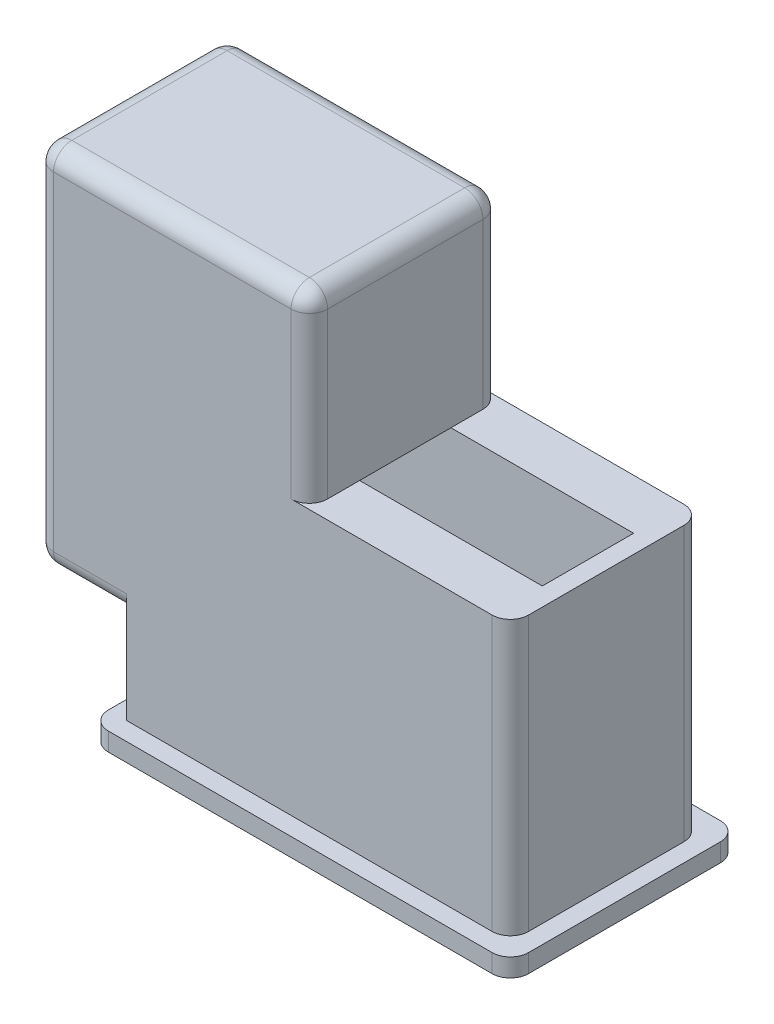
from build123d import *

# Parameters (mm, degrees)
SKETCH2_W               = 210
SKETCH2_H               = 105
SKETCH2_W_2             = 190
SKETCH2_H_2             = 50
BOSS_EXTRUDE2_DEPTH     = 150
FILLET3_R               = 10
FILLET4_R               = 10
SKETCH4_W               = 230
SKETCH4_H               = 125
BOSS_EXTRUDE3_DEPTH     = 10
FILLET5_R               = 10
FILLET6_R               = 10
FILLET7_R               = 10
FILLET8_R               = 10
SKETCH7_W               = 10
SKETCH7_H               = 50
BOSS_EXTRUDE4_DEPTH     = 93.9
SKETCH8_R               = 16.1
CUT_EXTRUDE2_DEPTH      = 10
SKETCH10_R              = 16.1
CUT_EXTRUDE3_DEPTH      = 10
SKETCH14_W              = 150
SKETCH14_H              = 105
BOSS_EXTRUDE6_DEPTH     = 100
CUT_EXTRUDE4_DEPTH      = 1
CUT_EXTRUDE4_DEPTH_BACK = 145
SKETCH19_W              = 95
SKETCH19_H              = 90
SKETCH22_W              = 50
SKETCH22_H              = 105
SKETCH22_W_2            = 35
SKETCH22_H_2            = 95
BOSS_EXTRUDE7_DEPTH     = 100
SKETCH24_W              = 40
SKETCH24_H              = 40
CUT_EXTRUDE5_DEPTH      = 10
SKETCH25_W              = 95.055428317
SKETCH25_H              = 90
BOSS_EXTRUDE9_DEPTH     = 5
FILLET9_R               = 10
FILLET10_R              = 10
FILLET11_R              = 10
FILLET12_R              = 10
FILLET13_R              = 10
FILLET15_R              = 10
SKETCH28_W              = 35
SKETCH28_H              = 95
CUT_EXTRUDE7_DEPTH      = 5


with BuildPart() as part:
    # Sketch2 → Boss-Extrude2 (new body)
    with BuildSketch(Plane(origin=(0, 0, 0), x_dir=(1, 0, 0), z_dir=(0, 1, 0))):
        Rectangle(SKETCH2_W, SKETCH2_H)
        Rectangle(SKETCH2_W_2, SKETCH2_H_2, mode=Mode.SUBTRACT)
    extrude(amount=BOSS_EXTRUDE2_DEPTH)

    # Fillet3
    fillet3_edges = [part.edges().sort_by_distance(p)[0] for p in [
        (105, 75, 52.5),
    ]]
    fillet(fillet3_edges, radius=FILLET3_R)

    # Fillet4
    fillet4_edges = [part.edges().sort_by_distance(p)[0] for p in [
        (105, 75, -52.5),
    ]]
    fillet(fillet4_edges, radius=FILLET4_R)

    # Sketch4 → Boss-Extrude3 (add)
    with BuildSketch(Plane(origin=(0, 0, 0), x_dir=(1, 0, 0), z_dir=(0, 1, 0))):
        Rectangle(SKETCH4_W, SKETCH4_H)
    extrude(amount=-BOSS_EXTRUDE3_DEPTH)

    # Fillet5
    fillet5_edges = [part.edges().sort_by_distance(p)[0] for p in [
        (115, -5, 62.5),
    ]]
    fillet(fillet5_edges, radius=FILLET5_R)

    # Fillet6
    fillet6_edges = [part.edges().sort_by_distance(p)[0] for p in [
        (115, -5, -62.5),
    ]]
    fillet(fillet6_edges, radius=FILLET6_R)

    # Fillet7
    fillet7_edges = [part.edges().sort_by_distance(p)[0] for p in [
        (-115, -5, -62.5),
    ]]
    fillet(fillet7_edges, radius=FILLET7_R)

    # Fillet8
    fillet8_edges = [part.edges().sort_by_distance(p)[0] for p in [
        (-115, -5, 62.5),
    ]]
    fillet(fillet8_edges, radius=FILLET8_R)

    # Sketch7 → Boss-Extrude4 (add)
    with BuildSketch(Plane(origin=(0, 0, 0), x_dir=(1, 0, 0), z_dir=(0, 1, 0))):
        Rectangle(SKETCH7_W, SKETCH7_H)
    extrude(amount=BOSS_EXTRUDE4_DEPTH)

    # Sketch8 → Cut-Extrude2 (cut)
    with BuildSketch(Plane.ZY.offset(5)):
        with Locations((0, 93.9)):
            Circle(SKETCH8_R)
    extrude(amount=-CUT_EXTRUDE2_DEPTH, mode=Mode.SUBTRACT)

    # Sketch10 → Cut-Extrude3 (cut)
    with BuildSketch(Plane.ZY.offset(105)):
        with Locations((0.019819576, 93.900003501)):
            Circle(SKETCH10_R)
    extrude(amount=-CUT_EXTRUDE3_DEPTH, mode=Mode.SUBTRACT)

    # Sketch14 → Boss-Extrude6 (add)
    with BuildSketch(Plane(origin=(0, 150, 0), x_dir=(1, 0, 0), z_dir=(0, 1, 0))):
        with Locations((-80, 0)):
            Rectangle(SKETCH14_W, SKETCH14_H)
    extrude(amount=BOSS_EXTRUDE6_DEPTH)

    # Sketch19 → Cut-Extrude4 (cut, two sides: drawn at the far end of the back side and taken through both)
    with BuildSketch(Plane.ZY.offset(155).offset(-CUT_EXTRUDE4_DEPTH_BACK)):
        with Locations((0, 200)):
            Rectangle(SKETCH19_W, SKETCH19_H)
    extrude(amount=CUT_EXTRUDE4_DEPTH + CUT_EXTRUDE4_DEPTH_BACK, mode=Mode.SUBTRACT)

    # Sketch22 → Boss-Extrude7 (add)
    with BuildSketch(Plane.XZ.offset(-150)):
        with Locations((-130, 0)):
            Rectangle(SKETCH22_W, SKETCH22_H)
        with Locations((-130, 0)):
            Rectangle(SKETCH22_W_2, SKETCH22_H_2, mode=Mode.SUBTRACT)
    extrude(amount=BOSS_EXTRUDE7_DEPTH)

    # Sketch24 → Cut-Extrude5 (cut)
    with BuildSketch(Plane(origin=(-105, 0, 0), x_dir=(0, 0, -1), z_dir=(1, 0, 0))):
        with Locations((-0.019819576, 93.900003501)):
            Rectangle(SKETCH24_W, SKETCH24_H)
    extrude(amount=-CUT_EXTRUDE5_DEPTH, mode=Mode.SUBTRACT)

    # Sketch25 → Boss-Extrude9 (add)
    with BuildSketch(Plane.ZY.offset(155)):
        with Locations((0.027714159, 200)):
            Rectangle(SKETCH25_W, SKETCH25_H)
    extrude(amount=-BOSS_EXTRUDE9_DEPTH)

    # Fillet9
    fillet9_edges = [part.edges().sort_by_distance(p)[0] for p in [
        (-80, 250, -52.5),
        (-155, 250, 0),
        (-80, 250, 52.5),
        (-5, 250, 0),
    ]]
    fillet(fillet9_edges, radius=FILLET9_R)

    # Fillet10
    # the kernel refuses this fillet: 10 mm, written as the material it takes off along each edge
    with BuildSketch(Plane(origin=(-145, 240, 42.5), x_dir=(-1, 0, 0), z_dir=(0, 0, 1))) as fillet10_piece_1_section:
        Polygon((0, 0), (FILLET10_R, 0), (FILLET10_R, -FILLET10_R), (0, -FILLET10_R), align=None)
    fillet10_piece_1 = extrude(amount=FILLET10_R, mode=Mode.PRIVATE)
    fillet10_piece_1 = fillet10_piece_1 - Plane(origin=(-145, 240, 42.5), x_dir=(0.7071067811865475, -0.7071067811865475, 0), z_dir=(0, 0, 1)) * Sphere(FILLET10_R, mode=Mode.PRIVATE)
    add(fillet10_piece_1, mode=Mode.SUBTRACT)
    with BuildSketch(Plane(origin=(-155, 240, 52.5), x_dir=(1, 0, 0), z_dir=(0, -1, 0))) as fillet10_piece_2:
        with BuildLine():
            CenterArc((FILLET10_R, -FILLET10_R), FILLET10_R, 90, 90)
            Line((0, -FILLET10_R), (0, 0))
            Line((0, 0), (FILLET10_R, 0))
        make_face()
    extrude(amount=215, mode=Mode.SUBTRACT)

    # Fillet11
    # the kernel refuses this fillet: 10 mm, written as the material it takes off along each edge
    with BuildSketch(Plane(origin=(-145, 240, -42.5), x_dir=(-1, 0, 0), z_dir=(0, 0, -1))) as fillet11_piece_1_section:
        Polygon((0, 0), (FILLET11_R, 0), (FILLET11_R, FILLET11_R), (0, FILLET11_R), align=None)
    fillet11_piece_1 = extrude(amount=FILLET11_R, mode=Mode.PRIVATE)
    fillet11_piece_1 = fillet11_piece_1 - Plane(origin=(-145, 240, -42.5), x_dir=(0.7071067811865475, -0.7071067811865475, 0), z_dir=(0, 0, -1)) * Sphere(FILLET11_R, mode=Mode.PRIVATE)
    add(fillet11_piece_1, mode=Mode.SUBTRACT)
    with BuildSketch(Plane(origin=(-155, 25, -52.5), x_dir=(1, 0, 0), z_dir=(0, 1, 0))) as fillet11_piece_2:
        with BuildLine():
            CenterArc((FILLET11_R, -FILLET11_R), FILLET11_R, 90, 90)
            Line((0, -FILLET11_R), (0, 0))
            Line((0, 0), (FILLET11_R, 0))
        make_face()
    extrude(amount=215, mode=Mode.SUBTRACT)

    # Fillet12
    # the kernel refuses this fillet: 10 mm, written as the material it takes off along each edge
    with BuildSketch(Plane(origin=(-15, 240, 42.5), x_dir=(1, 0, 0), z_dir=(0, 0, 1))) as fillet12_piece_1_section:
        Polygon((0, 0), (FILLET12_R, 0), (FILLET12_R, FILLET12_R), (0, FILLET12_R), align=None)
    fillet12_piece_1 = extrude(amount=FILLET12_R, mode=Mode.PRIVATE)
    fillet12_piece_1 = fillet12_piece_1 - Plane(origin=(-15, 240, 42.5), x_dir=(-0.7071067811865475, -0.7071067811865475, 0), z_dir=(0, 0, 1)) * Sphere(FILLET12_R, mode=Mode.PRIVATE)
    add(fillet12_piece_1, mode=Mode.SUBTRACT)
    with BuildSketch(Plane(origin=(-5, 150, 52.5), x_dir=(-1, 0, 0), z_dir=(0, 1, 0))) as fillet12_piece_2:
        with BuildLine():
            CenterArc((FILLET12_R, -FILLET12_R), FILLET12_R, 90, 90)
            Line((0, -FILLET12_R), (0, 0))
            Line((0, 0), (FILLET12_R, 0))
        make_face()
    extrude(amount=90, mode=Mode.SUBTRACT)

    # Fillet13
    # the kernel refuses this fillet: 10 mm, written as the material it takes off along each edge
    with BuildSketch(Plane(origin=(-15, 240, -42.5), x_dir=(1, 0, 0), z_dir=(0, 0, -1))) as fillet13_piece_1_section:
        Polygon((0, 0), (FILLET13_R, 0), (FILLET13_R, -FILLET13_R), (0, -FILLET13_R), align=None)
    fillet13_piece_1 = extrude(amount=FILLET13_R, mode=Mode.PRIVATE)
    fillet13_piece_1 = fillet13_piece_1 - Plane(origin=(-15, 240, -42.5), x_dir=(-0.7071067811865475, -0.7071067811865475, 0), z_dir=(0, 0, -1)) * Sphere(FILLET13_R, mode=Mode.PRIVATE)
    add(fillet13_piece_1, mode=Mode.SUBTRACT)
    with BuildSketch(Plane(origin=(-5, 150, -52.5), x_dir=(-1, 0, 0), z_dir=(0, 1, 0))) as fillet13_piece_2:
        with BuildLine():
            CenterArc((FILLET13_R, FILLET13_R), FILLET13_R, 180, 90)
            Line((0, FILLET13_R), (0, 0))
            Line((0, 0), (FILLET13_R, 0))
        make_face()
    extrude(amount=90, mode=Mode.SUBTRACT)

    # Fillet15
    # the kernel refuses this fillet: 10 mm, written as the material it takes off along each edge
    with BuildSketch(Plane(origin=(-145, 50, 52.5), x_dir=(0, 1, 0), z_dir=(1, 0, 0)), Plane(origin=(-105, 50, -52.5), x_dir=(0, 1, 0), z_dir=(-1, 0, 0))) as fillet15_piece_1:
        with BuildLine():
            CenterArc((FILLET15_R, -FILLET15_R), FILLET15_R, 90, 90)
            Line((0, -FILLET15_R), (0, 0))
            Line((0, 0), (FILLET15_R, 0))
        make_face()
    extrude(amount=40, mode=Mode.SUBTRACT)
    with BuildSketch(Plane(origin=(-155, 50, -42.5), x_dir=(0, 1, 0), z_dir=(0, 0, 1))) as fillet15_piece_2:
        with BuildLine():
            CenterArc((FILLET15_R, -FILLET15_R), FILLET15_R, 90, 90)
            Line((0, -FILLET15_R), (0, 0))
            Line((0, 0), (FILLET15_R, 0))
        make_face()
    extrude(amount=85, mode=Mode.SUBTRACT)
    with BuildSketch(Plane(origin=(-145, 50, 42.5), x_dir=(-1, 0, 0), z_dir=(0, 0, -1))) as fillet15_piece_3:
        with BuildLine():
            CenterArc((10 - FILLET15_R, FILLET15_R), FILLET15_R, 270, 90)
            Line((10, FILLET15_R), (10, 0))
            Line((10, 0), (10 - FILLET15_R, 0))
        make_face()
    revolve(axis=Axis((-145, 50, 42.5), (0, 1, 0)), revolution_arc=90, mode=Mode.SUBTRACT)
    with BuildSketch(Plane(origin=(-145, 50, -42.5), x_dir=(-1, 0, 0), z_dir=(0, 0, 1))) as fillet15_piece_4:
        with BuildLine():
            CenterArc((10 - FILLET15_R, -FILLET15_R), FILLET15_R, 0, 90)
            Line((10 - FILLET15_R, 0), (10, 0))
            Line((10, 0), (10, -FILLET15_R))
        make_face()
    revolve(axis=Axis((-145, 50, -42.5), (0, -1, 0)), revolution_arc=90, mode=Mode.SUBTRACT)

    # Sketch28 → Cut-Extrude7 (cut)
    with BuildSketch(Plane.XZ.offset(-150)):
        with Locations((-130, 0)):
            Rectangle(SKETCH28_W, SKETCH28_H)
    extrude(amount=-CUT_EXTRUDE7_DEPTH, mode=Mode.SUBTRACT)


solid = part.part
